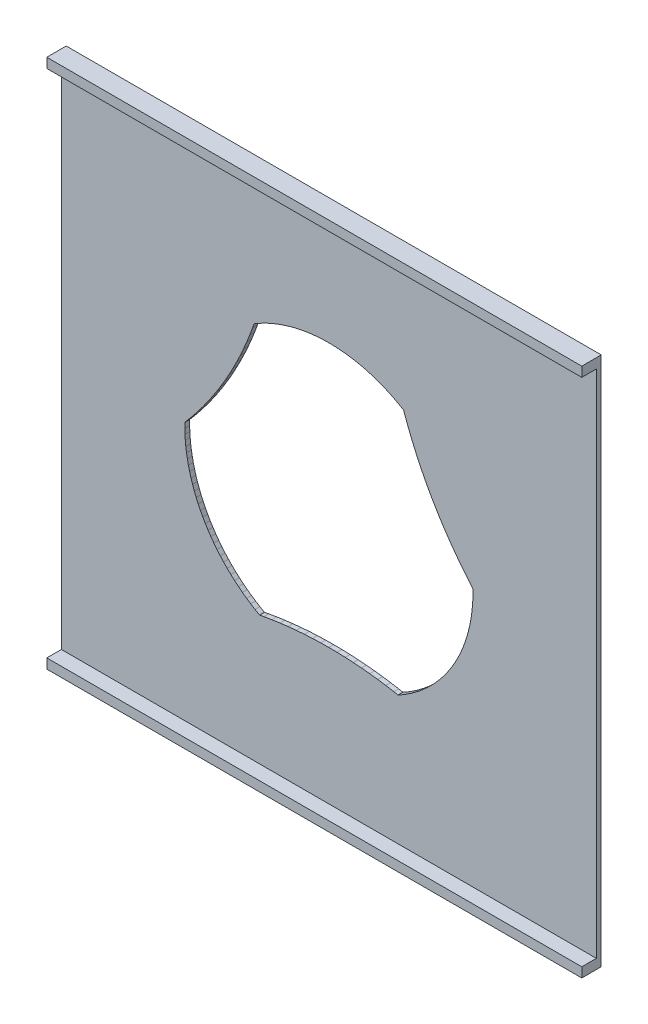
from build123d import *

# Parameters (mm, degrees)
SKETCH3_W           = 115.8494
SKETCH3_H           = 104.9528
BOSS_EXTRUDE1_DEPTH = 1
CUT_EXTRUDE1_DEPTH  = 235.728825061
SKETCH5_W           = 120.264695257
SKETCH5_H           = 108.9528
SKETCH5_W_2         = 115.8494
SKETCH5_H_2         = 104.9528
BOSS_EXTRUDE2_DEPTH = 4
SKETCH6_OUTSIDE_W   = 154.73
SKETCH6_OUTSIDE_H   = 143.418
SKETCH6_OUTSIDE_W_2 = 110
SKETCH6_OUTSIDE_H_2 = 108.9528
CUT_EXTRUDE3_DEPTH  = 238.688294416


with BuildPart() as part:
    # Sketch3 → Boss-Extrude1 (new body)
    with BuildSketch(Plane.XY):
        with Locations((83.819996366, -134.619998593)):
            Rectangle(SKETCH3_W, SKETCH3_H)
    extrude(amount=BOSS_EXTRUDE1_DEPTH)

    # Sketch4 → Cut-Extrude1 (cut, through all)
    with BuildSketch(Plane.XY):
        Polygon((54.224712, -133.936296), (54.23187, -133.922831), (54.781162, -133.287622), (55.85117, -131.993044), (56.89207, -130.674947), (57.903344, -129.333987), (58.884492, -127.970829), (59.835025, -126.58615), (60.754472, -125.180637), (61.642377, -123.754988), (62.498298, -122.309911), (63.321811, -120.846123), (64.112507, -119.36435), (64.869993, -117.865329), (65.593894, -116.349804), (66.28385, -114.818526), (66.939518, -113.272257), (67.560573, -111.711763), (68.146706, -110.13782), (68.422167, -109.344515), (68.43025, -109.33158), (68.435525, -109.317272), (68.444804, -109.308293), (68.451651, -109.29734), (68.464545, -109.289194), (68.475506, -109.278591), (69.374945, -108.755335), (70.292206, -108.26399), (71.226156, -107.805161), (72.175645, -107.379415), (73.139499, -106.987277), (74.11653, -106.629231), (75.105533, -106.305718), (76.105288, -106.017138), (77.11456, -105.763847), (78.132106, -105.546157), (79.156668, -105.364337), (80.186985, -105.218611), (81.221783, -105.109158), (82.259787, -105.036115), (83.299716, -104.999571), (84.340286, -104.999571), (85.380215, -105.036115), (86.418219, -105.109158), (87.453017, -105.218611), (88.483334, -105.364337), (89.507896, -105.546157), (90.525442, -105.763847), (91.534714, -106.017138), (92.534469, -106.305718), (93.523472, -106.629231), (94.500503, -106.987277), (95.464357, -107.379415), (96.413846, -107.805161), (97.347796, -108.26399), (98.265057, -108.755335), (99.164496, -109.278591), (99.175456, -109.289194), (99.188351, -109.29734), (99.195197, -109.308293), (99.204477, -109.317272), (99.209751, -109.33158), (99.217827, -109.344517), (99.493288, -110.137823), (100.079422, -111.711766), (100.700477, -113.27226), (101.356146, -114.818529), (102.046102, -116.349806), (102.770003, -117.865332), (103.52749, -119.364353), (104.318186, -120.846125), (105.1417, -122.309913), (105.997621, -123.75499), (106.885527, -125.180639), (107.804974, -126.586152), (108.755508, -127.970831), (109.736656, -129.333988), (110.747931, -130.674948), (111.788831, -131.993044), (112.858839, -133.287622), (113.408132, -133.922831), (113.415289, -133.936296), (113.425046, -133.94802), (113.428181, -133.960548), (113.434244, -133.971952), (113.43485, -133.98719), (113.438553, -134.001985), (113.441986, -135.04255), (113.408874, -136.082594), (113.339256, -137.120833), (113.233218, -138.155987), (113.090893, -139.186778), (112.912454, -140.211935), (112.698123, -141.230193), (112.448163, -142.240296), (112.162883, -143.240997), (111.842636, -144.231062), (111.487815, -145.20927), (111.09886, -146.174412), (110.676249, -147.1253), (110.220504, -148.060759), (109.732188, -148.979636), (109.211902, -149.880797), (108.66029, -150.763129), (108.078031, -151.625545), (107.465843, -152.466981), (106.824483, -153.286398), (106.15474, -154.082785), (105.457443, -154.85516), (104.73345, -155.60257), (103.983655, -156.324093), (103.208983, -157.018838), (102.410391, -157.685949), (101.588862, -158.324602), (100.745411, -158.93401), (99.881079, -159.51342), (98.996931, -160.062119), (98.094059, -160.579429), (98.079396, -160.583618), (98.065894, -160.590714), (98.052985, -160.591166), (98.04057, -160.594714), (98.025541, -160.592127), (98.010298, -160.592662), (97.185545, -160.434565), (95.529403, -160.1552), (93.867449, -159.912803), (92.200506, -159.707493), (90.529403, -159.539374), (88.854969, -159.408527), (87.178036, -159.315019), (85.499435, -159.258896), (83.820001, -159.240185), (82.140567, -159.258896), (80.461966, -159.315019), (78.785033, -159.408527), (77.110599, -159.539374), (75.439496, -159.707493), (73.772553, -159.912803), (72.110599, -160.1552), (70.454457, -160.434565), (69.629704, -160.592661), (69.61446, -160.592127), (69.599432, -160.594714), (69.587016, -160.591166), (69.574108, -160.590714), (69.560605, -160.583618), (69.545943, -160.579429), (68.643071, -160.06212), (67.758923, -159.513421), (66.89459, -158.934011), (66.051139, -158.324603), (65.229611, -157.68595), (64.431018, -157.018839), (63.656346, -156.324094), (62.906551, -155.602571), (62.182558, -154.855161), (61.48526, -154.082786), (60.815518, -153.286399), (60.174158, -152.466982), (59.56197, -151.625546), (58.979711, -150.76313), (58.428098, -149.880797), (57.907813, -148.979637), (57.419496, -148.06076), (56.963752, -147.125301), (56.541141, -146.174413), (56.152185, -145.20927), (55.797365, -144.231063), (55.477117, -143.240998), (55.191837, -142.240296), (54.941877, -141.230194), (54.727546, -140.211936), (54.549107, -139.186779), (54.406782, -138.155987), (54.300744, -137.120833), (54.231126, -136.082594), (54.198014, -135.04255), (54.201448, -134.001985), (54.205151, -133.98719), (54.205758, -133.971952), (54.21182, -133.960548), (54.214956, -133.94802), align=None)
    extrude(amount=CUT_EXTRUDE1_DEPTH, mode=Mode.SUBTRACT)

    # Sketch5 → Boss-Extrude2 (add)
    with BuildSketch(Plane.XY):
        with Locations((83.819996366, -134.619998593)):
            Rectangle(SKETCH5_W, SKETCH5_H)
        with Locations((83.819996366, -134.619998593)):
            Rectangle(SKETCH5_W_2, SKETCH5_H_2, mode=Mode.SUBTRACT)
    extrude(amount=BOSS_EXTRUDE2_DEPTH)

    # Sketch6 outside → Cut-Extrude3 (cut, through all)
    with BuildSketch(Plane.XY):
        with Locations((83.82, -134.62)):
            Rectangle(SKETCH6_OUTSIDE_W, SKETCH6_OUTSIDE_H)
        with Locations((83.819996366, -134.619998593)):
            Rectangle(SKETCH6_OUTSIDE_W_2, SKETCH6_OUTSIDE_H_2, mode=Mode.SUBTRACT)
    extrude(amount=CUT_EXTRUDE3_DEPTH, mode=Mode.SUBTRACT)


solid = part.part
